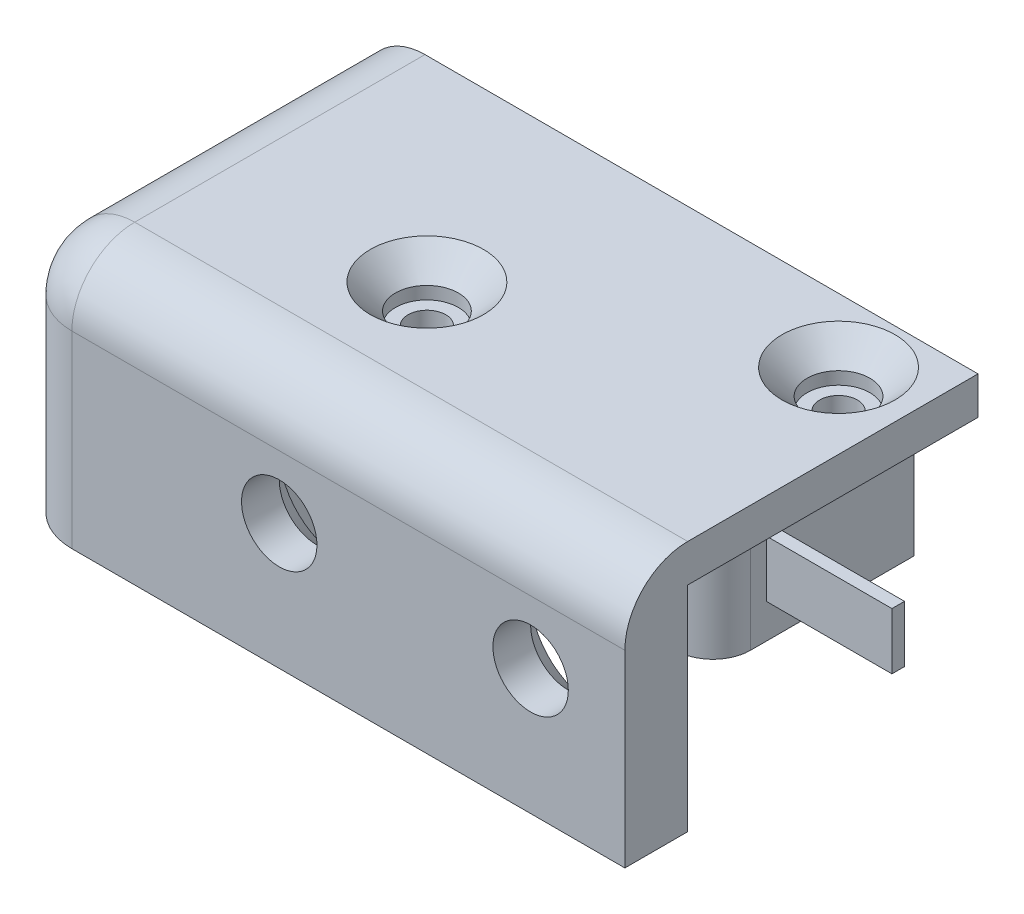
from build123d import *

# Parameters (mm, degrees)
LIMIT_START                     = -5
LIMIT_SWITCH_LARGER_OUTLINE_R   = 1.5
LIMIT_SWITCH_LARGER_DEPTH       = 10
LIMIT_START_2                   = -2.25
LIMIT_SWITCH_LARGER_2_OUTLINE_W = 10
LIMIT_SWITCH_LARGER_2_OUTLINE_H = 1
LIMIT_SWITCH_LARGER_2_DEPTH     = 4.5
SKETCH1_W                       = 49
SKETCH1_H                       = 28.096217126
SKETCH1_R                       = 2.5
BOSS_EXTRUDE2_DEPTH             = 3
BOSS_EXTRUDE3_DEPTH             = 17
SKETCH5_R                       = 3
CUT_EXTRUDE2_DEPTH              = 17
SKETCH6_R                       = 3
CUT_EXTRUDE3_DEPTH              = 61.033324079
CHAMFER2_SIZE                   = 2
FILLET2_R                       = 5
FILLET3_R                       = 5


with BuildPart() as part:
    # Limit Switch_Larger: read off the stored shape, not the designer's step
    # Limit Switch_Larger outline → Limit Switch_Larger (new body)
    with BuildSketch(Plane(origin=(0, 0, 0), x_dir=(1, 0, 0), z_dir=(0, 1, 0)).offset(LIMIT_START)):
        with BuildLine():
            Line((14, -5), (14, 8))
            Line((14, 8), (-11, 8))
            ThreePointArc((-11, 8), (-13.121320344, 7.121320344), (-14, 5))
            Line((-14, 5), (-14, -8))
            Line((-14, -8), (11, -8))
            ThreePointArc((11, -8), (13.121320344, -7.121320344), (14, -5))
        make_face()
        with Locations((-11.25, -5.5)):
            Circle(LIMIT_SWITCH_LARGER_OUTLINE_R, mode=Mode.SUBTRACT)
        with Locations((11, 5)):
            Circle(LIMIT_SWITCH_LARGER_OUTLINE_R, mode=Mode.SUBTRACT)
    extrude(amount=LIMIT_SWITCH_LARGER_DEPTH)

    # Limit Switch_Larger 2 outline → Limit Switch_Larger 2 (add)
    with BuildSketch(Plane(origin=(0, 0, 0), x_dir=(1, 0, 0), z_dir=(0, 1, 0)).offset(LIMIT_START_2)):
        with Locations((19, -3.25)):
            Rectangle(LIMIT_SWITCH_LARGER_2_OUTLINE_W, LIMIT_SWITCH_LARGER_2_OUTLINE_H)
        with BuildLine():
            Line((1.5, 8), (2.5, 8))
            Line((2.5, 8), (2.5, 9.10197349))
            ThreePointArc((2.5, 9.10197349), (2.244023809, 9.770126595), (1.607142857, 10.096217126))
            Line((1.607142857, 10.096217126), (-25.338821814, 13))
            Line((-25.338821814, 13), (-25.445964671, 12.005756364))
            Line((-25.445964671, 12.005756364), (1.5, 9.10197349))
            Line((1.5, 9.10197349), (1.5, 8))
        make_face()
        with BuildLine():
            Line((0.3, -9), (0.3, -8))
            Line((0.3, -8), (-0.7, -8))
            Line((-0.7, -8), (-0.7, -9))
            ThreePointArc((-0.7, -9), (-0.114213562, -10.414213562), (1.3, -11))
            Line((1.3, -11), (10.3, -11))
            Line((10.3, -11), (10.3, -10))
            Line((10.3, -10), (1.3, -10))
            ThreePointArc((1.3, -10), (0.592893219, -9.707106781), (0.3, -9))
        make_face()
    extrude(amount=LIMIT_SWITCH_LARGER_2_DEPTH)


with BuildPart() as body_2:
    # Sketch1 → Boss-Extrude2 (new body)
    with BuildSketch(Plane(origin=(0, 5, 0), x_dir=(1, 0, 0), z_dir=(0, 1, 0))):
        with Locations((-7.5, -3.951891437)):
            Rectangle(SKETCH1_W, SKETCH1_H)
        with Locations(Location((-11.25, -5.5, 0), (0, 0, 270))):
            Circle(SKETCH1_R, mode=Mode.SUBTRACT)
        with Locations(Location((11, 5, 0), (0, 0, 270))):
            Circle(SKETCH1_R, mode=Mode.SUBTRACT)
    extrude(amount=BOSS_EXTRUDE2_DEPTH)

    # Sketch1<3> → Boss-Extrude3 (add)
    with BuildSketch(Plane(origin=(0, 5, 0), x_dir=(1, 0, 0), z_dir=(0, 1, 0))):
        Polygon((17, -18), (17, -13), (-15, -13), (-15, 7.096217126), (-32, 7.096217126), (-32, -18), align=None)
    extrude(amount=-BOSS_EXTRUDE3_DEPTH)

    # Sketch5 → Cut-Extrude2 (cut)
    with BuildSketch(Plane.XY.offset(18)):
        with Locations((-10.5, -2)):
            Circle(SKETCH5_R)
        with Locations((9.5, -2)):
            Circle(SKETCH5_R)
    extrude(amount=-CUT_EXTRUDE2_DEPTH, mode=Mode.SUBTRACT)

    # Sketch6 → Cut-Extrude3 (cut, through all)
    with BuildSketch(Plane.ZY.offset(32)):
        with Locations((0.403782874, -2)):
            Circle(SKETCH6_R)
    extrude(amount=-CUT_EXTRUDE3_DEPTH, mode=Mode.SUBTRACT)

    # Chamfer2
    # the kernel refuses this chamfer: 2 mm, written as the material it takes off along each edge
    with BuildSketch(Plane(origin=(-11.25, 8, 5.5), x_dir=(0, 0, 1), z_dir=(-1, 0, 0))) as chamfer2_piece_1:
        Polygon((2.5 + CHAMFER2_SIZE, 0), (2.5, -CHAMFER2_SIZE), (2.5, 0), align=None)
    revolve(axis=Axis((-11.25, 8, 5.5), (0, 1, 0)), mode=Mode.SUBTRACT)
    with BuildSketch(Plane(origin=(11, 8, -5), x_dir=(0, 0, 1), z_dir=(-1, 0, 0))) as chamfer2_piece_2:
        Polygon((2.5 + CHAMFER2_SIZE, 0), (2.5, -CHAMFER2_SIZE), (2.5, 0), align=None)
    revolve(axis=Axis((11, 8, -5), (0, 1, 0)), mode=Mode.SUBTRACT)
    with BuildSketch(Plane(origin=(-10.5, -2, 13), x_dir=(1, 0, 0), z_dir=(0, -1, 0))) as chamfer2_piece_3_section:
        Polygon((3 + CHAMFER2_SIZE, 0), (3, CHAMFER2_SIZE), (3, 0), align=None)
    chamfer2_piece_3 = revolve(axis=Axis((-10.5, -2, 13), (0, 0, 1)), mode=Mode.PRIVATE)
    chamfer2_piece_3 = split(chamfer2_piece_3, bisect_by=Plane(origin=(-15, -2, 13), z_dir=(1, 0, 0)), keep=Keep.TOP, mode=Mode.PRIVATE)
    add(chamfer2_piece_3, mode=Mode.SUBTRACT)
    with BuildSketch(Plane(origin=(9.5, -2, 13), x_dir=(1, 0, 0), z_dir=(0, -1, 0))) as chamfer2_piece_4:
        Polygon((3 + CHAMFER2_SIZE, 0), (3, CHAMFER2_SIZE), (3, 0), align=None)
    revolve(axis=Axis((9.5, -2, 13), (0, 0, 1)), mode=Mode.SUBTRACT)
    with BuildSketch(Plane(origin=(-15, -2, 0.403782874), x_dir=(0, 0, 1), z_dir=(0, -1, 0))) as chamfer2_piece_5:
        Polygon((3, CHAMFER2_SIZE), (3 + CHAMFER2_SIZE, 0), (3, 0), align=None)
    revolve(axis=Axis((-15, -2, 0.403782874), (-1, 0, 0)), mode=Mode.SUBTRACT)

    # Fillet2
    # the kernel refuses this fillet: 5 mm, written as the material it adds along each edge
    with BuildSketch(Plane(origin=(-15, 5, -7.096217126), x_dir=(0, 0, -1), z_dir=(-1, 0, 0))) as fillet2_piece_1:
        with BuildLine():
            CenterArc((5, 4.582575695), FILLET2_R, 180, 66.421821522)
            Line((0, 4.582575695), (0, 0))
            Line((0, 0), (3, 0))
        make_face()
    extrude(amount=17)
    # the kernel refuses this fillet: 5 mm, written as the material it takes off along each edge
    with BuildSketch(Plane(origin=(-32, -24.5, 18), x_dir=(1, 0, 0), z_dir=(0, 1, 0))) as fillet2_2_piece_1:
        with BuildLine():
            CenterArc((FILLET2_R, FILLET2_R), FILLET2_R, 180, 90)
            Line((0, FILLET2_R), (0, 0))
            Line((0, 0), (FILLET2_R, 0))
        make_face()
    extrude(amount=45, mode=Mode.SUBTRACT)
    with BuildSketch(Plane(origin=(-44.5, 8, 18), x_dir=(0, 0, -1), z_dir=(1, 0, 0))) as fillet2_2_piece_2:
        with BuildLine():
            CenterArc((FILLET2_R, -FILLET2_R), FILLET2_R, 90, 90)
            Line((0, -FILLET2_R), (0, 0))
            Line((0, 0), (FILLET2_R, 0))
        make_face()
    extrude(amount=74, mode=Mode.SUBTRACT)

    # Fillet3
    # the kernel refuses this fillet: 5 mm, written as the material it takes off along each edge
    with BuildSketch(Plane(origin=(-27, 3, 13), x_dir=(0, 1, 0), z_dir=(-1, 0, 0))) as fillet3_piece_1_section:
        Polygon((0, 0), (FILLET3_R, 0), (FILLET3_R, -FILLET3_R), (0, -FILLET3_R), align=None)
    fillet3_piece_1 = extrude(amount=FILLET3_R, mode=Mode.PRIVATE)
    fillet3_piece_1 = fillet3_piece_1 - Plane(origin=(-27, 3, 13), x_dir=(0, -0.7071067811865475, -0.7071067811865475), z_dir=(-1, 0, 0)) * Sphere(FILLET3_R, mode=Mode.PRIVATE)
    add(fillet3_piece_1, mode=Mode.SUBTRACT)
    with BuildSketch(Plane(origin=(-32, 8, -22.596217126), x_dir=(0, -1, 0), z_dir=(0, 0, 1))) as fillet3_piece_2:
        with BuildLine():
            CenterArc((FILLET3_R, FILLET3_R), FILLET3_R, 180, 90)
            Line((0, FILLET3_R), (0, 0))
            Line((0, 0), (FILLET3_R, 0))
        make_face()
    extrude(amount=35.596217126, mode=Mode.SUBTRACT)


solid = Compound([part.part, body_2.part])
